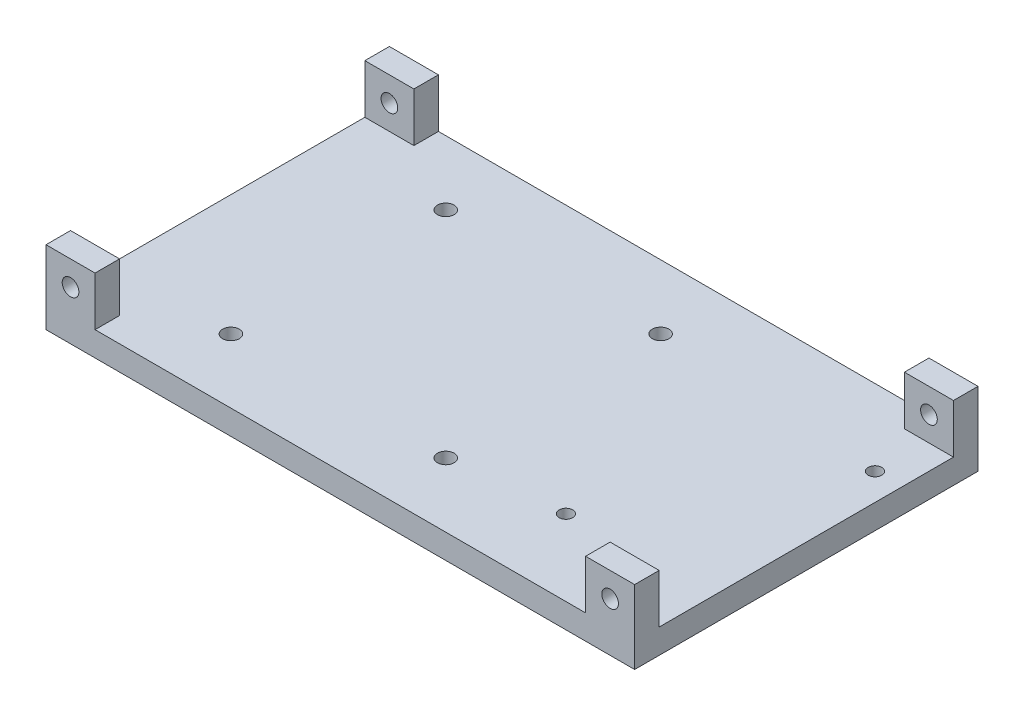
from build123d import *

# Parameters (mm, degrees)
SKETCH1_W            = 120
SKETCH1_H            = 70
BOSS_EXTRUDE2_DEPTH  = 5
SKETCH2_W            = 10
SKETCH2_H            = 5
BOSS_EXTRUDE3_DEPTH  = 10
M3_CLEARANCE_HOLE1_D = 3.4
SKETCH5_R            = 1.39
CUT_EXTRUDE1_DEPTH   = 140.731886125
M3_CLEARANCE_HOLE2_D = 3.4


with BuildPart() as part:
    # Sketch1 → Boss-Extrude2 (new body)
    with BuildSketch(Plane(origin=(0, 0, 0), x_dir=(1, 0, 0), z_dir=(0, 1, 0))):
        with Locations((-60, 35)):
            Rectangle(SKETCH1_W, SKETCH1_H)
    extrude(amount=BOSS_EXTRUDE2_DEPTH)

    # Sketch2 → Boss-Extrude3 (add)
    with BuildSketch(Plane(origin=(0, 5, 0), x_dir=(1, 0, 0), z_dir=(0, 1, 0))):
        with Locations((-115, 2.5)):
            Rectangle(SKETCH2_W, SKETCH2_H)
        with Locations((-115, 67.5)):
            Rectangle(SKETCH2_W, SKETCH2_H)
        with Locations((-5, 2.5)):
            Rectangle(SKETCH2_W, SKETCH2_H)
        with Locations((-5, 67.5)):
            Rectangle(SKETCH2_W, SKETCH2_H)
    extrude(amount=BOSS_EXTRUDE3_DEPTH)

    # M3 Clearance Hole1 (through all)
    with Locations(Plane.XY):
        with Locations((-115, 10), (-5, 10)):
            Hole(M3_CLEARANCE_HOLE1_D / 2)

    # Sketch5 → Cut-Extrude1 (cut, through all)
    with BuildSketch(Plane.XZ):
        with Locations((-5.5, -54.5)):
            Circle(SKETCH5_R)
        with Locations((-29.5, -15.5)):
            Circle(SKETCH5_R)
    extrude(amount=-CUT_EXTRUDE1_DEPTH, mode=Mode.SUBTRACT)

    # M3 Clearance Hole2 (through all)
    with Locations(Plane(origin=(0, 0, 0), x_dir=(-1, 0, 0), z_dir=(0, -1, 0))):
        with Locations((95.4, 13.1), (51.6, 13.1), (51.6, 56.9), (95.4, 56.9)):
            Hole(M3_CLEARANCE_HOLE2_D / 2)


solid = part.part
